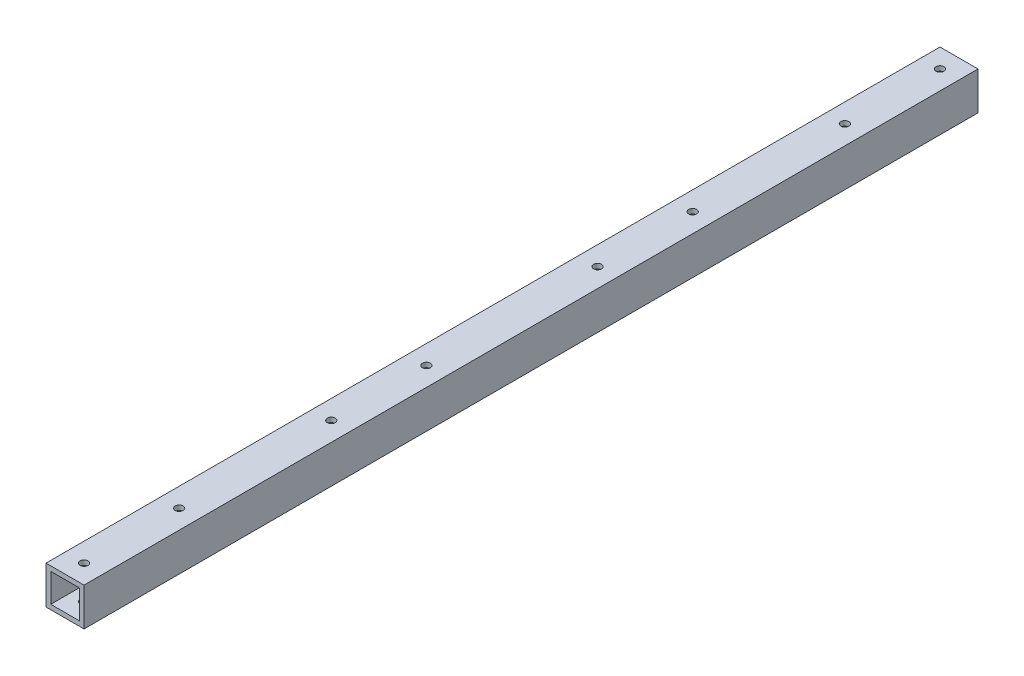
from build123d import *

# Parameters (mm, degrees)
SKETCH1_W           = 25.4
SKETCH1_H           = 25.4
SKETCH1_W_2         = 19.05
SKETCH1_H_2         = 19.05
BOSS_EXTRUDE1_DEPTH = 596.9
SKETCH2_R           = 2.667
CUT_EXTRUDE1_DEPTH  = 598.979874243
SKETCH4_R           = 2.667
CUT_EXTRUDE3_DEPTH  = 25.4


with BuildPart() as part:
    # Sketch1 → Boss-Extrude1 (new body)
    with BuildSketch(Plane.XY):
        with Locations((12.7, 12.7)):
            Rectangle(SKETCH1_W, SKETCH1_H)
        with Locations((12.7, 12.7)):
            Rectangle(SKETCH1_W_2, SKETCH1_H_2, mode=Mode.SUBTRACT)
    extrude(amount=BOSS_EXTRUDE1_DEPTH)

    # Sketch2 → Cut-Extrude1 (cut, through all)
    with BuildSketch(Plane(origin=(0, 25.4, 0), x_dir=(1, 0, 0), z_dir=(0, 1, 0))):
        with Locations((12.7, -584.2)):
            Circle(SKETCH2_R)
        with Locations((12.7, -12.7)):
            Circle(SKETCH2_R)
        with Locations((12.7, -520.7)):
            Circle(SKETCH2_R)
        with Locations((12.7, -76.2)):
            Circle(SKETCH2_R)
    extrude(amount=-CUT_EXTRUDE1_DEPTH, mode=Mode.SUBTRACT)

    # Sketch4 → Cut-Extrude3 (cut)
    with BuildSketch(Plane(origin=(0, 25.4, 0), x_dir=(1, 0, 0), z_dir=(0, 1, 0))):
        with Locations((12.7, -419.1)):
            Circle(SKETCH4_R)
        with Locations((12.7, -355.6)):
            Circle(SKETCH4_R)
        with Locations((12.7, -177.8)):
            Circle(SKETCH4_R)
        with Locations((12.7, -241.3)):
            Circle(SKETCH4_R)
    extrude(amount=-CUT_EXTRUDE3_DEPTH, mode=Mode.SUBTRACT)


solid = part.part
